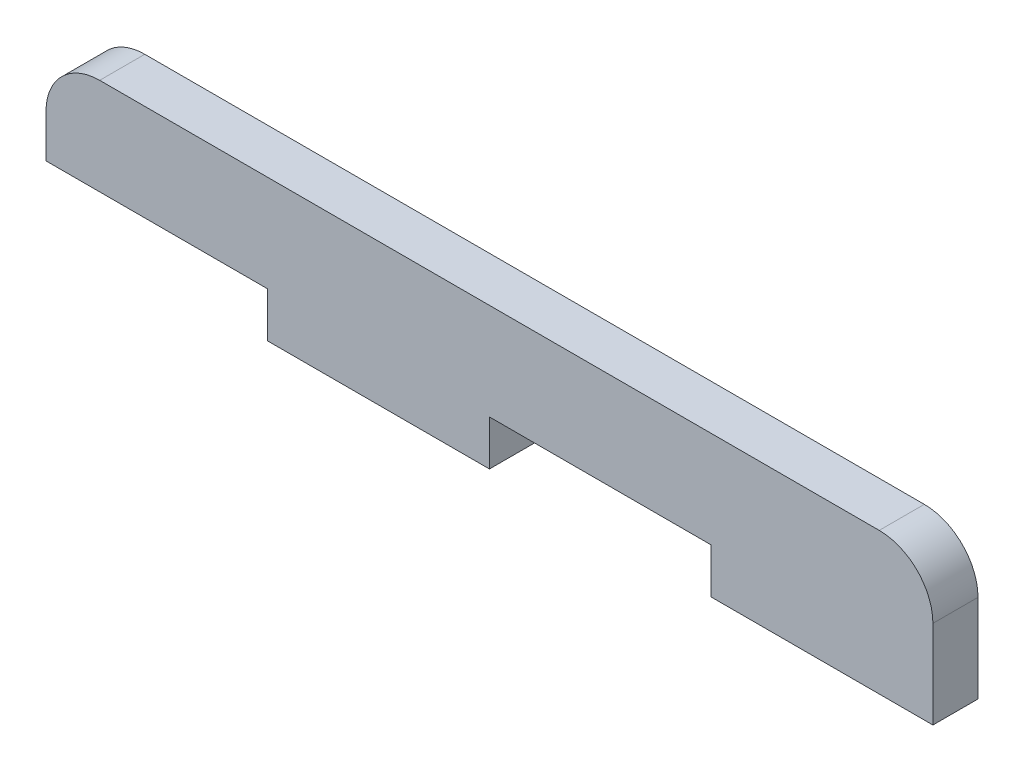
from build123d import *

# Parameters (mm, degrees)
SKETCH1_W           = 104.902
SKETCH1_H           = 16.764
BOSS_EXTRUDE1_DEPTH = 5.334
SKETCH2_W           = 26.2255
SKETCH2_H           = 5.334
CUT_EXTRUDE1_DEPTH  = 59.030232747
FILLET1_R           = 6.35


with BuildPart() as part:
    # Sketch1 → Boss-Extrude1 (new body)
    with BuildSketch(Plane.XY):
        with Locations((-4.604300362, -0.769451102)):
            Rectangle(SKETCH1_W, SKETCH1_H)
    extrude(amount=BOSS_EXTRUDE1_DEPTH)

    # Sketch2 → Cut-Extrude1 (cut, through all)
    with BuildSketch(Plane.XY.offset(5.334)):
        with Locations((-43.942550362, -6.484451102)):
            Rectangle(SKETCH2_W, SKETCH2_H)
        with Locations((8.508449638, -6.484451102)):
            Rectangle(SKETCH2_W, SKETCH2_H)
    extrude(amount=-CUT_EXTRUDE1_DEPTH, mode=Mode.SUBTRACT)

    # Fillet1
    fillet1_edges = [part.edges().sort_by_distance(p)[0] for p in [
        (47.846699638, 7.612548898, 2.667),
        (-57.055300362, 7.612548898, 2.667),
    ]]
    fillet(fillet1_edges, radius=FILLET1_R)


solid = part.part
